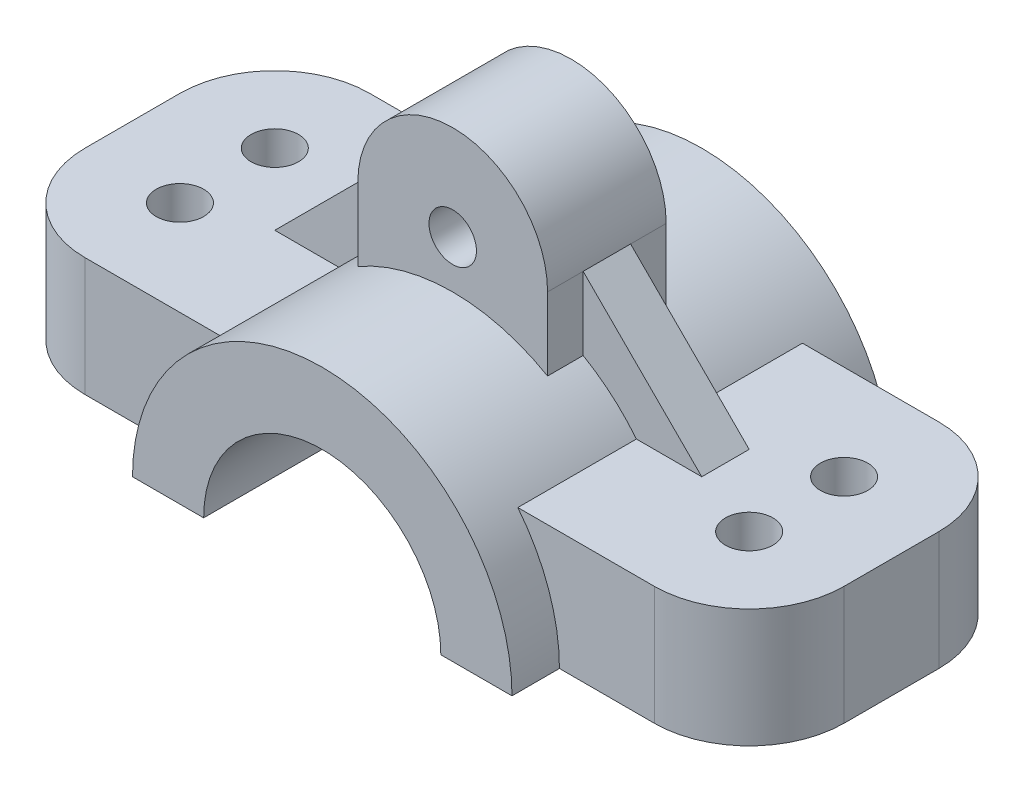
from build123d import *

# Parameters (mm, degrees)
BOSS_EXTRUDE1_DEPTH        = 40
SKETCH2_W                  = 70
SKETCH2_H                  = 60
BOSS_EXTRUDE2_DEPTH        = 25
FILLET1_R                  = 20
F_10_0_10_DIAMETER_HOLE1_D = 10
FILLET1_OF_MIRROR1_R       = 20
DELETEFACE1_START          = -30
DELETEFACE1_DEPTH          = 60
SKETCH5_R                  = 5
BOSS_EXTRUDE3_DEPTH        = 12.5015
RIB1_REACH                 = 115.578
SKETCH6_WALL_W             = 264.511672892
SKETCH6_WALL_H             = 10


# Read off the part's stored shape, not the designer's step: DeleteFace1
with BuildPart() as part:
    # Sketch1 → Boss-Extrude1 (new, symmetric)
    with BuildSketch(Plane.XY):
        with BuildLine():
            Line((-40, 0), (-25, 0))
            ThreePointArc((-25, 0), (0, 25), (25, 0))
            Line((25, 0), (40, 0))
            ThreePointArc((40, 0), (0, 40), (-40, 0))
        make_face()
    extrude(amount=BOSS_EXTRUDE1_DEPTH, both=True)

    # Sketch2 → Boss-Extrude2 (add)
    with BuildSketch(Plane.XZ):
        with Locations((-45, 0)):
            Rectangle(SKETCH2_W, SKETCH2_H)
    boss_extrude2 = extrude(amount=-BOSS_EXTRUDE2_DEPTH)

    # Fillet1
    fillet1_edges = [part.edges().sort_by_distance(p)[0] for p in [
        (-80, 12.5, 30),
        (-80, 12.5, -30),
    ]]
    fillet(fillet1_edges, radius=FILLET1_R)

    # Ø10.0 (10) Diameter Hole1 (through all)
    with Locations(Plane(origin=(0, 25, 0), x_dir=(1, 0, 0), z_dir=(0, 1, 0))):
        with Locations((-60, -10), (-60, 10)):
            f_10_0_10_diameter_hole1 = Hole(F_10_0_10_DIAMETER_HOLE1_D / 2)

    # Mirror1: Boss-Extrude2, Ø10.0 (10) Diameter Hole1 across plane
    add(boss_extrude2.mirror(Plane(origin=(0, 0, 0), x_dir=(0, 0, 1), z_dir=(1, 0, 0))))
    add(f_10_0_10_diameter_hole1.mirror(Plane(origin=(0, 0, 0), x_dir=(0, 0, 1), z_dir=(1, 0, 0))), mode=Mode.SUBTRACT)

    # Fillet1 of Mirror1
    fillet1_of_mirror1_edges = [part.edges().sort_by_distance(p)[0] for p in [
        (80, 12.5, 30),
        (80, 12.5, -30),
    ]]
    fillet(fillet1_of_mirror1_edges, radius=FILLET1_OF_MIRROR1_R)

    # DeleteFace1 outline → DeleteFace1 (cut)
    with BuildSketch(Plane.XY.offset(DELETEFACE1_START)):
        with BuildLine():
            ThreePointArc((25, 0), (20.916500663, 13.693063938), (10, 22.912878475))
            Line((10, 22.912878475), (10, 0))
            Line((10, 0), (25, 0))
        make_face()
        with BuildLine():
            ThreePointArc((-10, 22.912878475), (-20.916500663, 13.693063938), (-25, 0))
            Line((-25, 0), (-10, 0))
            Line((-10, 0), (-10, 22.912878475))
        make_face()
    extrude(amount=DELETEFACE1_DEPTH, mode=Mode.SUBTRACT)

    # Sketch5 → Boss-Extrude3 (add, symmetric)
    with BuildSketch(Plane.XY):
        with BuildLine():
            Line((-20, 50), (-20, 34.641016151))
            ThreePointArc((-20, 34.641016151), (0, 40), (20, 34.641016151))
            Line((20, 34.641016151), (20, 50))
            ThreePointArc((20, 50), (0, 70), (-20, 50))
        make_face()
        with Locations((0, 50)):
            Circle(SKETCH5_R, mode=Mode.SUBTRACT)
    extrude(amount=BOSS_EXTRUDE3_DEPTH, both=True)

    # Sketch6 wall → Rib1 (add, up to next)
    with BuildSketch(Plane(origin=(-32.5, 37.5, 0), x_dir=(0.707106781187, 0.707106781187, 0), z_dir=(-0.707106781187, 0.707106781187, 0)), mode=Mode.PRIVATE) as rib1_sk1:
        Rectangle(SKETCH6_WALL_W, SKETCH6_WALL_H)
    rib1_tool1 = extrude(rib1_sk1.sketch, amount=-RIB1_REACH, mode=Mode.PRIVATE) - part.part
    rib1 = rib1_tool1.solids().sort_by_distance((-32.5, 37.5, 0))[0]
    add(rib1)

    # Mirror2: Rib1 across plane
    add(rib1.mirror(Plane(origin=(0, 0, 0), x_dir=(0, 0, 1), z_dir=(1, 0, 0))))


solid = part.part
